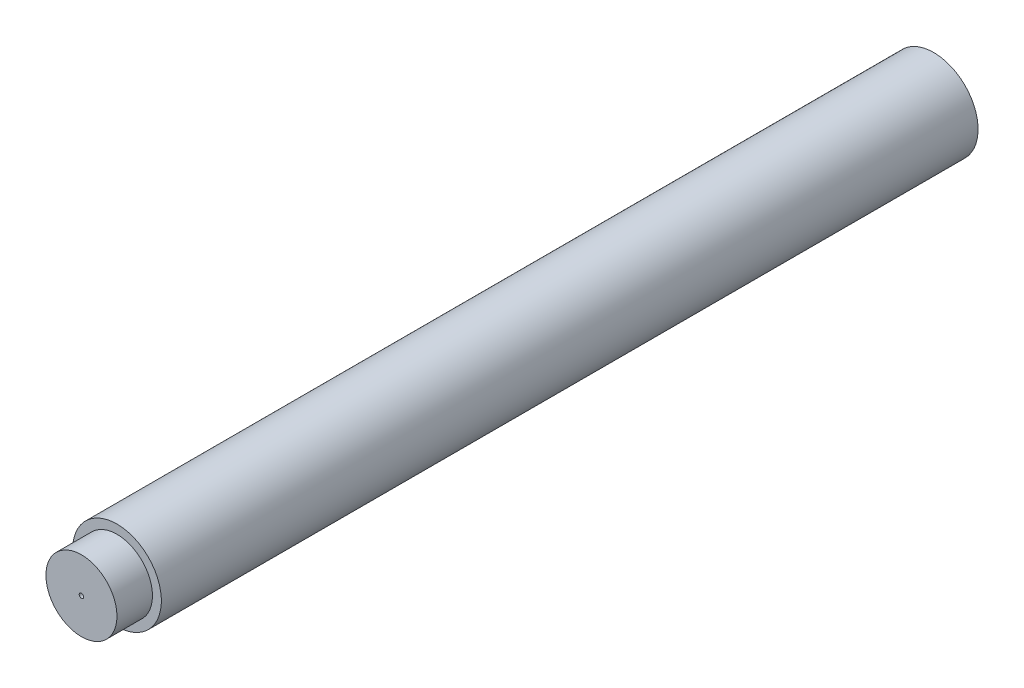
from build123d import *

# Parameters (mm, degrees)
SKETCH3_R           = 7.9375
BOSS_EXTRUDE1_DEPTH = 76.2
SKETCH5_OUTSIDE_W   = 48.682
SKETCH5_OUTSIDE_H   = 48.682
SKETCH5_OUTSIDE_R   = 6.35
CUT_EXTRUDE1_DEPTH  = 6.35
SKETCH6_R           = 0.396875
CUT_EXTRUDE2_DEPTH  = 152.4
FILLET5_SIZE        = 3.4925
FILLET5_SIZE_2      = 12.7


with BuildPart() as part:
    # Sketch3 → Boss-Extrude1 (new, symmetric)
    with BuildSketch(Plane.XY):
        with Locations(Location((0, 0, 0), (0, 0, 180))):
            Circle(SKETCH3_R)
    extrude(amount=BOSS_EXTRUDE1_DEPTH, both=True)

    # Sketch5 outside → Cut-Extrude1 (cut)
    with BuildSketch(Plane.XY.offset(76.2)):
        Rectangle(SKETCH5_OUTSIDE_W, SKETCH5_OUTSIDE_H)
        Circle(SKETCH5_OUTSIDE_R, mode=Mode.SUBTRACT)
    extrude(amount=-CUT_EXTRUDE1_DEPTH, mode=Mode.SUBTRACT)

    # Sketch6 → Cut-Extrude2 (cut)
    with BuildSketch(Plane(origin=(0, 0, -76.2), x_dir=(-1, 0, 0), z_dir=(0, 0, -1))):
        Circle(SKETCH6_R)
    extrude(amount=-CUT_EXTRUDE2_DEPTH, mode=Mode.SUBTRACT)

    # Fillet5
    # a fillet whose section is not a circle: 12.7, 3.4925 mm, written as the material it takes off along each edge
    with BuildSketch(Plane(origin=(0, 0, -76.2), x_dir=(-1, 0, 0), z_dir=(0, -1, 0))) as fillet5_piece_1:
        with BuildLine():
            Bezier((0.396875 + FILLET5_SIZE, 0), (0.396875, 0), (0.396875, -FILLET5_SIZE_2), weights=[1, 0.25, 1])
            Line((0.396875, -FILLET5_SIZE_2), (0.396875, 0))
            Line((0.396875, 0), (0.396875 + FILLET5_SIZE, 0))
        make_face()
    revolve(axis=Axis((0, 0, -76.2), (0, 0, -1)), mode=Mode.SUBTRACT)


solid = part.part
